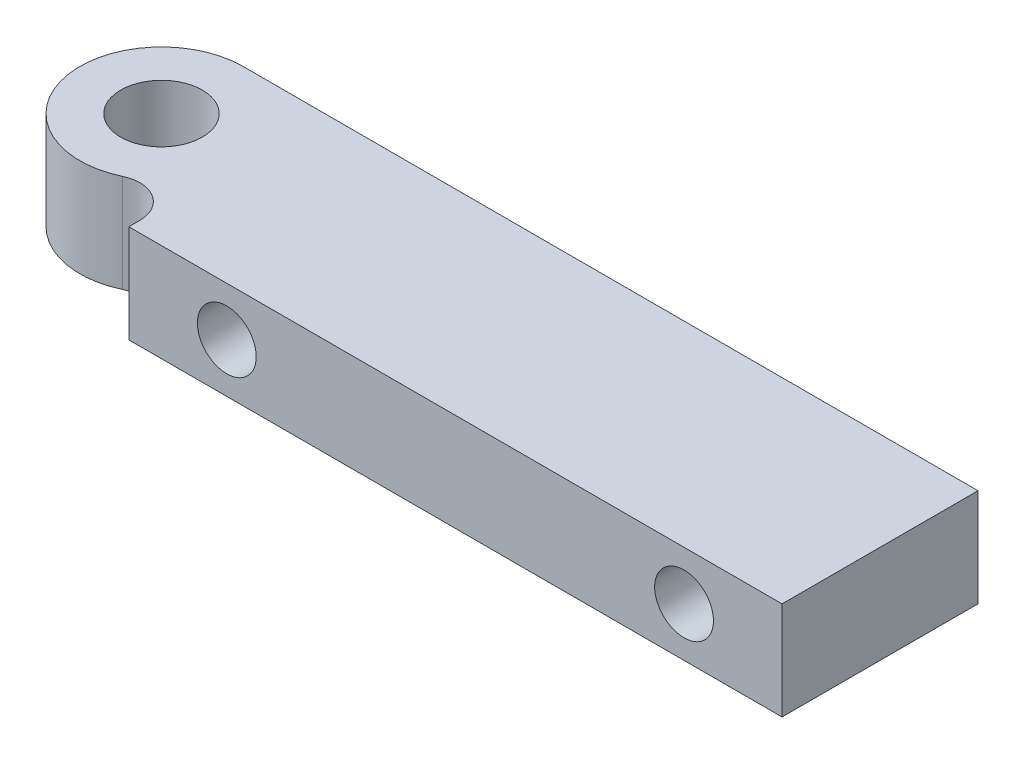
from build123d import *

# Parameters (mm, degrees)
SKETCH1_R           = 3.175
BOSS_EXTRUDE1_DEPTH = 3.8099999999999996
FILLET1_R           = 2.54
SKETCH2_R           = 2.285999999997823
SKETCH2_R_2         = 2.28599999999783
CUT_EXTRUDE1_DEPTH  = 5.08


with BuildPart() as part:
    # Sketch1 → Boss-Extrude1 (new, symmetric)
    with BuildSketch(Plane(origin=(0, 0, 0), x_dir=(1, 0, 0), z_dir=(0, 1, 0))):
        with BuildLine():
            Line((0, 6.35), (12.366459894249573, 6.35))
            Line((12.366459894249573, 6.35), (57.15, 6.35))
            Line((57.15, 6.35), (57.15, -8.889999999999999))
            Line((57.15, -8.889999999999999), (6.350000000000001, -8.889999999999999))
            Line((6.350000000000001, -8.889999999999999), (6.3500000000000005, 8.7e-16))
            ThreePointArc((6.3500000000000005, 8.7e-16), (-4.490128060534578, -4.490128060534576), (0, 6.35))
        make_face()
        Circle(SKETCH1_R, mode=Mode.SUBTRACT)
    extrude(amount=BOSS_EXTRUDE1_DEPTH, both=True)

    # Fillet1
    fillet1_edges = [part.edges().sort_by_distance(p)[0] for p in [
        (6.350000000000001, 0, -8.7e-16),
    ]]
    fillet(fillet1_edges, radius=FILLET1_R)

    # Sketch2 → Cut-Extrude1 (cut)
    with BuildSketch(Plane.XY.offset(8.889999999999999)):
        with Locations((49.5300000000024, -5.64e-15)):
            Circle(SKETCH2_R)
        with Locations((13.970000000002369, -5.64e-15)):
            Circle(SKETCH2_R_2)
    extrude(amount=-CUT_EXTRUDE1_DEPTH, mode=Mode.SUBTRACT)


solid = part.part
